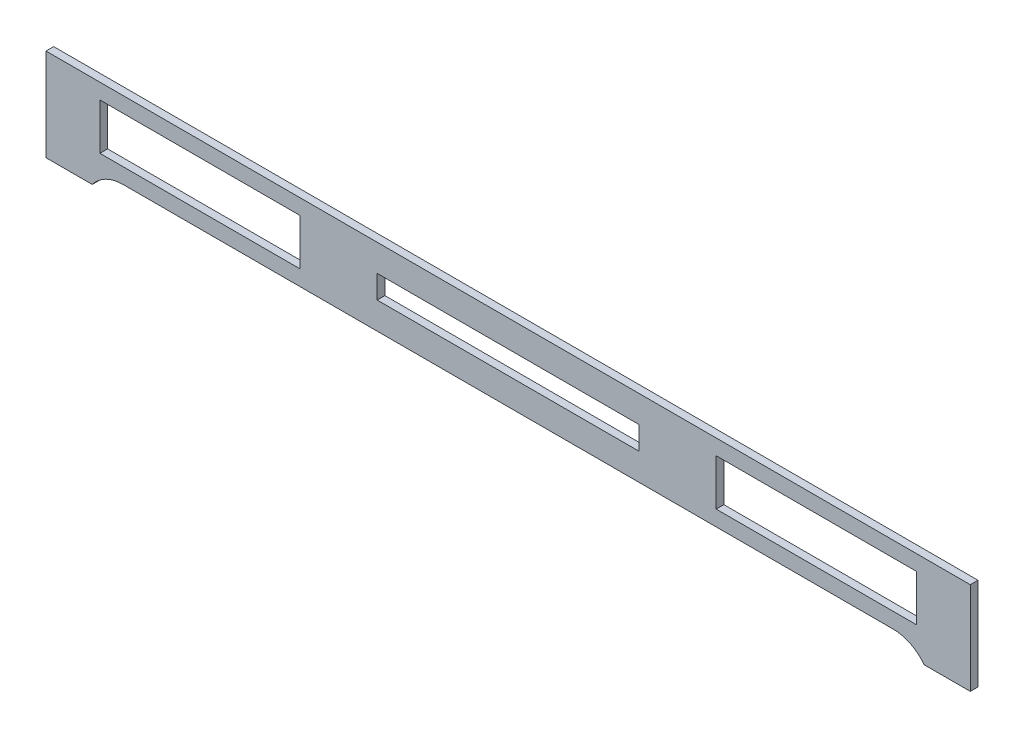
from build123d import *

# Parameters (mm, degrees)
BOSS_EXTRUDE1_DEPTH = 5
SKETCH2_W           = 130
SKETCH2_H           = 30
SKETCH2_W_2         = 170
SKETCH2_H_2         = 15
CUT_EXTRUDE1_DEPTH  = 603.100489952


with BuildPart() as part:
    # Sketch1 → Boss-Extrude1 (new body)
    with BuildSketch(Plane.XY):
        with BuildLine():
            Line((0, 0), (0, -10))
            Line((0, -10), (30, -10))
            ThreePointArc((30, -10), (38.819660113, -2.639320225), (50, 0))
            Line((50, 0), (550, 0))
            ThreePointArc((550, 0), (561.180339887, -2.639320225), (570, -10))
            Line((570, -10), (600, -10))
            Line((600, -10), (600, 0))
            Line((600, 0), (600, 50))
            Line((600, 50), (0, 50))
            Line((0, 50), (0, 0))
        make_face()
    extrude(amount=BOSS_EXTRUDE1_DEPTH)

    # Sketch2 → Cut-Extrude1 (cut, through all)
    with BuildSketch(Plane.XY.offset(5)):
        with Locations((100, 25)):
            Rectangle(SKETCH2_W, SKETCH2_H)
        with Locations((300, 25)):
            Rectangle(SKETCH2_W_2, SKETCH2_H_2)
        with Locations((500, 25)):
            Rectangle(SKETCH2_W, SKETCH2_H)
    extrude(amount=-CUT_EXTRUDE1_DEPTH, mode=Mode.SUBTRACT)


solid = part.part
